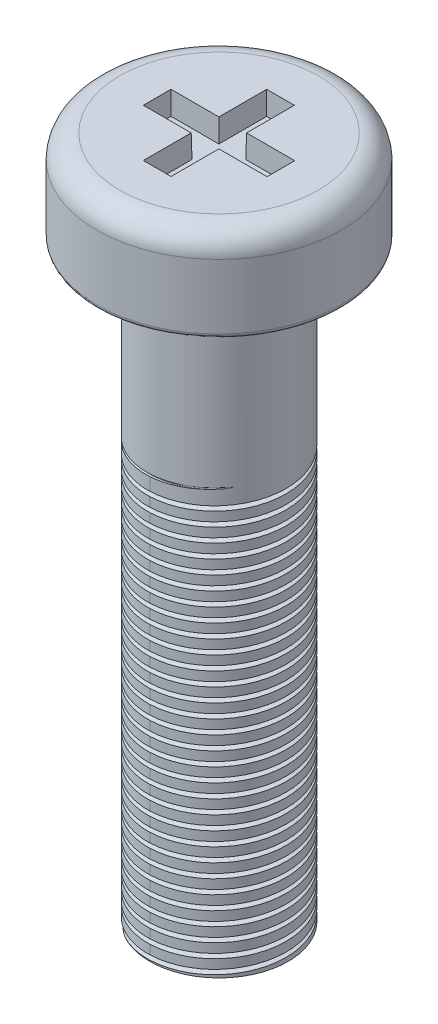
from build123d import *

# Parameters (mm, degrees)
SKETCH1_R              = 2.65
BOSS_EXTRUDE1_DEPTH    = 2
SKETCH2_R              = 1.5
BOSS_EXTRUDE2_DEPTH    = 12.8
FILLET1_R              = 0.5
FILLET2_R              = 0.1
CUT_EXTRUDE1_DEPTH     = 0.5
CUT_EXTRUDE1_DRAFT     = -1
CUT_SWEEP1_PITCH       = 0.3
CUT_SWEEP2_PITCH       = 0.577350269
CUT_SWEEP2_HEIGHT      = 1
CUT_SWEEP2_RADIUS      = 1.5
CUT_SWEEP2_START_ANGLE = -90


with BuildPart() as part:
    # Sketch1 → Boss-Extrude1 (new body)
    with BuildSketch(Plane(origin=(0, 0, 0), x_dir=(1, 0, 0), z_dir=(0, 1, 0))):
        with Locations(Location((0, 0, 0), (0, 0, 270))):
            Circle(SKETCH1_R)
    extrude(amount=BOSS_EXTRUDE1_DEPTH)

    # Sketch2 → Boss-Extrude2 (add)
    with BuildSketch(Plane.XZ):
        with Locations(Location((0, 0, 0), (0, 0, 90))):
            Circle(SKETCH2_R)
    extrude(amount=BOSS_EXTRUDE2_DEPTH)

    # Fillet1
    fillet1_edges = [part.edges().sort_by_distance(p)[0] for p in [
        (0, 2, -2.65),
    ]]
    fillet(fillet1_edges, radius=FILLET1_R)

    # Fillet2
    fillet2_edges = [part.edges().sort_by_distance(p)[0] for p in [
        (0, 0, -2.65),
    ]]
    fillet(fillet2_edges, radius=FILLET2_R)


with BuildPart() as cut_extrude1_tool:
    # Sketch3 → Cut-Extrude1 (with draft: the straight prism first)
    with BuildSketch(Plane(origin=(0, 2, 0), x_dir=(1, 0, 0), z_dir=(0, 1, 0))):
        Polygon((0.296573117, 0.3), (0.296573117, 1.336133674), (-0.303426883, 1.336133674), (-0.303426883, 0.3), (-1.340662941, 0.3), (-1.340662941, -0.3), (-0.303426883, -0.3), (-0.303426883, -1.336133674), (0.296573117, -1.336133674), (0.296573117, -0.3), (1.340662941, -0.3), (1.340662941, 0.3), align=None)
    extrude(amount=-CUT_EXTRUDE1_DEPTH)
    # Cut-Extrude1: the draft: its side faces are tilted about the plane it starts from
    cut_extrude1_sides = [cut_extrude1_tool.faces().sort_by_distance(p)[0] for p in [
        (0.296573117, 1.75, -0.818066837),
        (-0.003426883, 1.75, -1.336133674),
        (-0.303426883, 1.75, -0.818066837),
        (-0.822044912, 1.75, -0.3),
        (-1.340662941, 1.75, 0),
        (-0.822044912, 1.75, 0.3),
        (-0.303426883, 1.75, 0.818066837),
        (-0.003426883, 1.75, 1.336133674),
        (0.296573117, 1.75, 0.818066837),
        (0.818618029, 1.75, 0.3),
        (1.340662941, 1.75, 0),
        (0.818618029, 1.75, -0.3),
    ]]
    draft(cut_extrude1_sides, Plane(origin=(0, 2, 0), x_dir=(1, 0, 0), z_dir=(0, 1, 0)), CUT_EXTRUDE1_DRAFT)


with BuildPart() as part_1:
    add(part.part)

    # Cut-Extrude1: cut by cut_extrude1_tool
    add(cut_extrude1_tool.part, mode=Mode.SUBTRACT)

    # Cut-Sweep1: arcs per turn and ends read off the stored shape
    # Cut-Sweep1: the profile of Sketch5 profile screwed along a right-hand helix through 31 turns, 6 arcs to a turn; built about Z, then put on its axis
    cut_sweep1_z = Axis((0, 0, 0), (0, 0, 1))
    cut_sweep1_corners = [(1.5003, 0, -0.350102443), (1.5003, 0, -0.249897557), (1.395057267, 0, -0.285835362), (1.384926433, 0, -0.3), (1.395057267, 0, -0.314164638)]
    with BuildLine(mode=Mode.PRIVATE) as cut_sweep1_profile:
        Line(cut_sweep1_corners[0], cut_sweep1_corners[1])
        Line(cut_sweep1_corners[1], cut_sweep1_corners[2])
        Line(cut_sweep1_corners[4], cut_sweep1_corners[0])
        ThreePointArc((1.395057267, 0, -0.285835362), (1.387719799, 0, -0.291292665), (1.384926433, 0, -0.3))
        ThreePointArc((1.384926433, 0, -0.3), (1.387719799, 0, -0.308707335), (1.395057267, 0, -0.314164638))
    cut_sweep1_cap = Face(cut_sweep1_profile.wire())
    cut_sweep1_arcs = [((1.395057267, 0, -0.285835362), (1.384926433, 0, -0.289294793), (1.384926433, 0, -0.3), (1, 0.8133738426895888, 1)), ((1.384926433, 0, -0.3), (1.384926433, 0, -0.310705207), (1.395057267, 0, -0.314164638), (1, 0.8133738426895888, 1))]  # start, shoulder, end, weights
    cut_sweep1_turn_angles = [0, 30, 60, 90, 120, 150, 180, 210, 240, 270, 300, 330, 360]
    cut_sweep1_turn_weights = [1, 0.8660254037844387, 1, 0.8660254037844387, 1, 0.8660254037844387, 1, 0.8660254037844387, 1, 0.8660254037844387, 1, 0.8660254037844387, 1]
    cut_sweep1_turn_rails = [Edge.make_bspline([Vector(p[0], p[1], 0).rotate(cut_sweep1_z, cut_sweep1_turn_angles[k]) / cut_sweep1_turn_weights[k] + Vector(0, 0, p[2] + CUT_SWEEP1_PITCH * cut_sweep1_turn_angles[k] / 360) for k in range(13)], [0, 0, 0, 1, 1, 2, 2, 3, 3, 4, 4, 5, 5, 6, 6, 6], 2, cut_sweep1_turn_weights) for p in cut_sweep1_corners]
    cut_sweep1_turn_sides = [*[Face.make_surface_from_curves(cut_sweep1_turn_rails[p[0]], cut_sweep1_turn_rails[p[1]]) for p in [(0, 1), (1, 2), (4, 0)]], *[Face.make_bezier_surface([[Vector(p[j][0], p[j][1], 0).rotate(cut_sweep1_z, cut_sweep1_turn_angles[2 * i + k]) / cut_sweep1_turn_weights[2 * i + k] + Vector(0, 0, p[j][2] + CUT_SWEEP1_PITCH * cut_sweep1_turn_angles[2 * i + k] / 360) for k in range(3)] for j in range(3)], [[p[3][j] * cut_sweep1_turn_weights[2 * i + k] for k in range(3)] for j in range(3)]) for p in cut_sweep1_arcs for i in range(6)]]
    cut_sweep1 = Plane(origin=(0, -12.8, 0), x_dir=(-1, 0, 0), z_dir=(0, 1, 0)) * Solid(Shell([*[p.moved(Location((0, 0, CUT_SWEEP1_PITCH * i))) for i in range(31) for p in cut_sweep1_turn_sides], cut_sweep1_cap, cut_sweep1_cap.rotate(cut_sweep1_z, 11160).moved(Location((0, 0, CUT_SWEEP1_PITCH * 11160 / 360)))]))
    add(cut_sweep1, mode=Mode.SUBTRACT)

    # Cut-Sweep2: sweep along a helix
    with BuildLine() as cut_sweep2_path:
        # a taper helix: rise per turn along the axis 0.5, along the cone's slant (build123d's pitch) 0.577350269
        add(Helix(CUT_SWEEP2_PITCH, CUT_SWEEP2_HEIGHT, CUT_SWEEP2_RADIUS, center=(0, -3.8, 0), direction=(0, 1, 0), cone_angle=30, mode=Mode.PRIVATE).rotate(Axis((0, -3.8, 0), (0, 1, 0)), CUT_SWEEP2_START_ANGLE))
    # Sketch7 → Cut-Sweep2 (sweep, cut)
    with BuildSketch(Plane(origin=(0, 0, 0), x_dir=(-1, 0, 0), z_dir=(0, 0, -1))):
        with BuildLine():
            Line((1.502646609, -3.749096248), (1.502646609, -3.850903752))
            Line((1.502646609, -3.850903752), (1.395057267, -3.814164638))
            ThreePointArc((1.395057267, -3.814164638), (1.384926433, -3.8), (1.395057267, -3.785835362))
            Line((1.395057267, -3.785835362), (1.502646609, -3.749096248))
        make_face()
    sweep(path=cut_sweep2_path.line, is_frenet=True, mode=Mode.SUBTRACT)


solid = part_1.part
